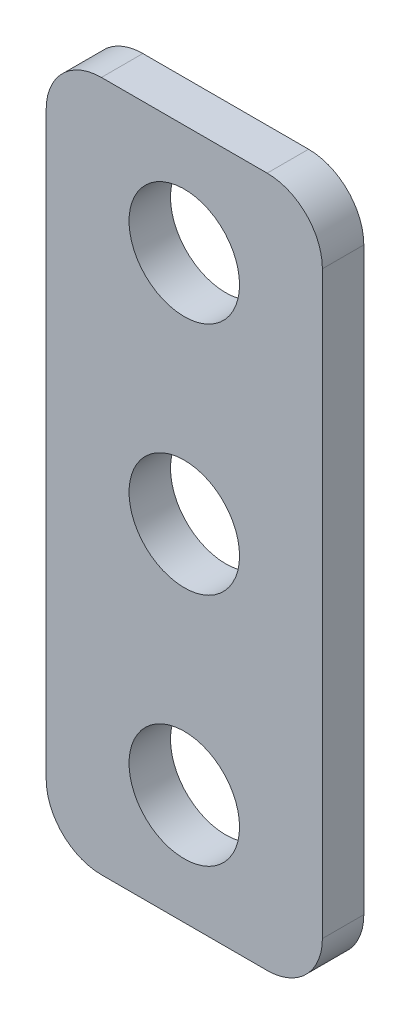
from build123d import *

# Parameters (mm, degrees)
SKETCH_1_W             = 20
SKETCH_1_H             = 50
SM_BASE_FLANGE_1_DEPTH = 3
SKETCH_6_R             = 4
CUT_EXTRUDE_1_DEPTH    = 10
FILLET_1_R             = 4


# Sheet-metal steps are written as plain solids
with BuildPart() as part:
    # Sketch 1 → 基体-法兰1 (new body)
    with BuildSketch(Plane.XY):
        Rectangle(SKETCH_1_W, SKETCH_1_H)
    extrude(amount=-SM_BASE_FLANGE_1_DEPTH)

    # 草图6 → 切除-拉伸1 (cut)
    with BuildSketch(Plane.XY):
        with Locations((0, 17)):
            Circle(SKETCH_6_R)
        with Locations((0, -17)):
            Circle(SKETCH_6_R)
        Circle(SKETCH_6_R)
    extrude(amount=-CUT_EXTRUDE_1_DEPTH, mode=Mode.SUBTRACT)

    # 圆角1
    fillet_1_edges = [part.edges().sort_by_distance(p)[0] for p in [
        (10, -25, -1.5),
        (-10, -25, -1.5),
        (-10, 25, -1.5),
        (10, 25, -1.5),
    ]]
    fillet(fillet_1_edges, radius=FILLET_1_R)


solid = part.part
